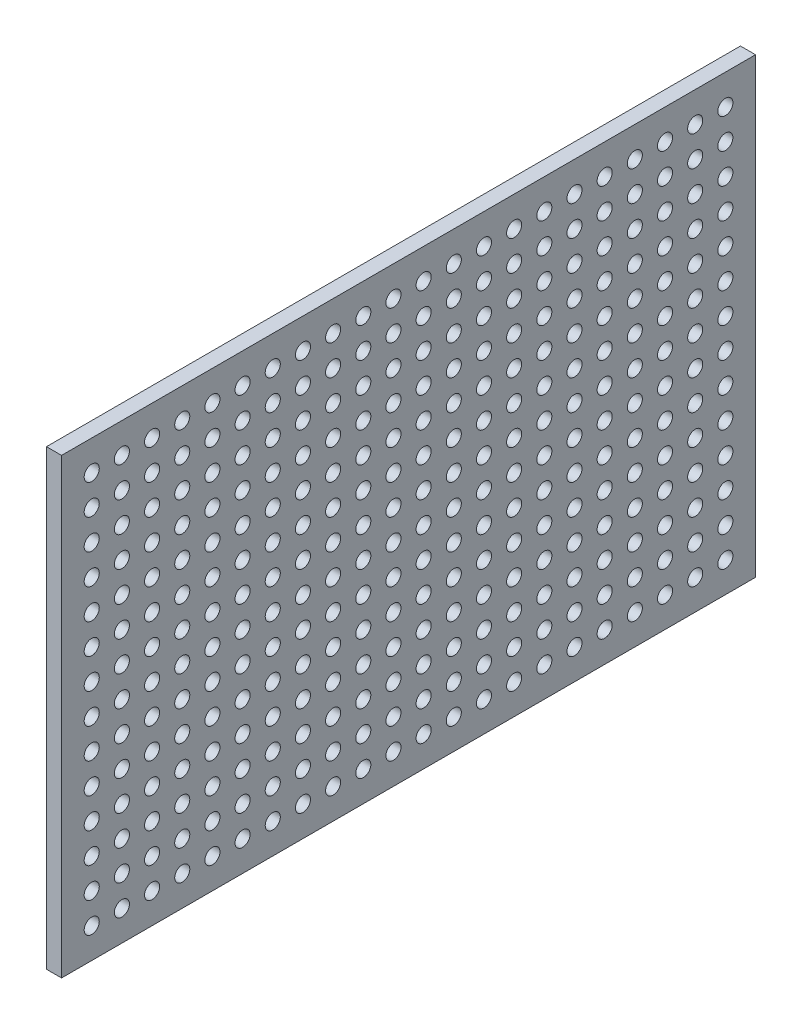
from build123d import *

# Parameters (mm, degrees)
SKIZZE1_W                       = 230
SKIZZE1_H                       = 150
AUFSATZ_LINEAR_AUSTRAGEN1_DEPTH = 5
SKIZZE2_R                       = 2.5
SCHNITT_LINEAR_AUSTRAGEN1_DEPTH = 138.38631664
LINEARES_MUSTER1_OUTLINE_R      = 2.5
LINEARES_MUSTER1_DEPTH          = 5


# Read off the part's stored shape, not the designer's step: Lineares Muster1
with BuildPart() as part:
    # Skizze1 → Aufsatz-Linear austragen1 (new body)
    with BuildSketch(Plane(origin=(0, 0, 0), x_dir=(0, 0, -1), z_dir=(1, 0, 0))):
        Rectangle(SKIZZE1_W, SKIZZE1_H)
    extrude(amount=AUFSATZ_LINEAR_AUSTRAGEN1_DEPTH)

    # Skizze2 → Schnitt-Linear austragen1 (cut, through all)
    with BuildSketch(Plane(origin=(5, 0, 0), x_dir=(0, 0, -1), z_dir=(1, 0, 0))):
        with Locations((-105, 65)):
            Circle(SKIZZE2_R)
    extrude(amount=-SCHNITT_LINEAR_AUSTRAGEN1_DEPTH, mode=Mode.SUBTRACT)

    # Lineares Muster1 outline → Lineares Muster1 (cut)
    with BuildSketch(Plane.YZ):
        with Locations((55, 105)):
            Circle(LINEARES_MUSTER1_OUTLINE_R)
        with Locations((45, 105)):
            Circle(LINEARES_MUSTER1_OUTLINE_R)
        with Locations((35, 105)):
            Circle(LINEARES_MUSTER1_OUTLINE_R)
        with Locations((25, 105)):
            Circle(LINEARES_MUSTER1_OUTLINE_R)
        with Locations((15, 105)):
            Circle(LINEARES_MUSTER1_OUTLINE_R)
        with Locations((5, 105)):
            Circle(LINEARES_MUSTER1_OUTLINE_R)
        with Locations((-5, 105)):
            Circle(LINEARES_MUSTER1_OUTLINE_R)
        with Locations((-15, 105)):
            Circle(LINEARES_MUSTER1_OUTLINE_R)
        with Locations((-25, 105)):
            Circle(LINEARES_MUSTER1_OUTLINE_R)
        with Locations((-35, 105)):
            Circle(LINEARES_MUSTER1_OUTLINE_R)
        with Locations((-45, 105)):
            Circle(LINEARES_MUSTER1_OUTLINE_R)
        with Locations((-55, 105)):
            Circle(LINEARES_MUSTER1_OUTLINE_R)
        with Locations((-65, 105)):
            Circle(LINEARES_MUSTER1_OUTLINE_R)
        with Locations((65, 95)):
            Circle(LINEARES_MUSTER1_OUTLINE_R)
        with Locations((55, 95)):
            Circle(LINEARES_MUSTER1_OUTLINE_R)
        with Locations((45, 95)):
            Circle(LINEARES_MUSTER1_OUTLINE_R)
        with Locations((35, 95)):
            Circle(LINEARES_MUSTER1_OUTLINE_R)
        with Locations((25, 95)):
            Circle(LINEARES_MUSTER1_OUTLINE_R)
        with Locations((15, 95)):
            Circle(LINEARES_MUSTER1_OUTLINE_R)
        with Locations((5, 95)):
            Circle(LINEARES_MUSTER1_OUTLINE_R)
        with Locations((-5, 95)):
            Circle(LINEARES_MUSTER1_OUTLINE_R)
        with Locations((-15, 95)):
            Circle(LINEARES_MUSTER1_OUTLINE_R)
        with Locations((-25, 95)):
            Circle(LINEARES_MUSTER1_OUTLINE_R)
        with Locations((-35, 95)):
            Circle(LINEARES_MUSTER1_OUTLINE_R)
        with Locations((-45, 95)):
            Circle(LINEARES_MUSTER1_OUTLINE_R)
        with Locations((-55, 95)):
            Circle(LINEARES_MUSTER1_OUTLINE_R)
        with Locations((-65, 95)):
            Circle(LINEARES_MUSTER1_OUTLINE_R)
        with Locations((65, 85)):
            Circle(LINEARES_MUSTER1_OUTLINE_R)
        with Locations((55, 85)):
            Circle(LINEARES_MUSTER1_OUTLINE_R)
        with Locations((45, 85)):
            Circle(LINEARES_MUSTER1_OUTLINE_R)
        with Locations((35, 85)):
            Circle(LINEARES_MUSTER1_OUTLINE_R)
        with Locations((25, 85)):
            Circle(LINEARES_MUSTER1_OUTLINE_R)
        with Locations((15, 85)):
            Circle(LINEARES_MUSTER1_OUTLINE_R)
        with Locations((5, 85)):
            Circle(LINEARES_MUSTER1_OUTLINE_R)
        with Locations((-5, 85)):
            Circle(LINEARES_MUSTER1_OUTLINE_R)
        with Locations((-15, 85)):
            Circle(LINEARES_MUSTER1_OUTLINE_R)
        with Locations((-25, 85)):
            Circle(LINEARES_MUSTER1_OUTLINE_R)
        with Locations((-35, 85)):
            Circle(LINEARES_MUSTER1_OUTLINE_R)
        with Locations((-45, 85)):
            Circle(LINEARES_MUSTER1_OUTLINE_R)
        with Locations((-55, 85)):
            Circle(LINEARES_MUSTER1_OUTLINE_R)
        with Locations((-65, 85)):
            Circle(LINEARES_MUSTER1_OUTLINE_R)
        with Locations((65, 75)):
            Circle(LINEARES_MUSTER1_OUTLINE_R)
        with Locations((55, 75)):
            Circle(LINEARES_MUSTER1_OUTLINE_R)
        with Locations((45, 75)):
            Circle(LINEARES_MUSTER1_OUTLINE_R)
        with Locations((35, 75)):
            Circle(LINEARES_MUSTER1_OUTLINE_R)
        with Locations((25, 75)):
            Circle(LINEARES_MUSTER1_OUTLINE_R)
        with Locations((15, 75)):
            Circle(LINEARES_MUSTER1_OUTLINE_R)
        with Locations((5, 75)):
            Circle(LINEARES_MUSTER1_OUTLINE_R)
        with Locations((-5, 75)):
            Circle(LINEARES_MUSTER1_OUTLINE_R)
        with Locations((-15, 75)):
            Circle(LINEARES_MUSTER1_OUTLINE_R)
        with Locations((-25, 75)):
            Circle(LINEARES_MUSTER1_OUTLINE_R)
        with Locations((-35, 75)):
            Circle(LINEARES_MUSTER1_OUTLINE_R)
        with Locations((-45, 75)):
            Circle(LINEARES_MUSTER1_OUTLINE_R)
        with Locations((-55, 75)):
            Circle(LINEARES_MUSTER1_OUTLINE_R)
        with Locations((-65, 75)):
            Circle(LINEARES_MUSTER1_OUTLINE_R)
        with Locations((65, 65)):
            Circle(LINEARES_MUSTER1_OUTLINE_R)
        with Locations((55, 65)):
            Circle(LINEARES_MUSTER1_OUTLINE_R)
        with Locations((45, 65)):
            Circle(LINEARES_MUSTER1_OUTLINE_R)
        with Locations((35, 65)):
            Circle(LINEARES_MUSTER1_OUTLINE_R)
        with Locations((25, 65)):
            Circle(LINEARES_MUSTER1_OUTLINE_R)
        with Locations((15, 65)):
            Circle(LINEARES_MUSTER1_OUTLINE_R)
        with Locations((5, 65)):
            Circle(LINEARES_MUSTER1_OUTLINE_R)
        with Locations((-5, 65)):
            Circle(LINEARES_MUSTER1_OUTLINE_R)
        with Locations((-15, 65)):
            Circle(LINEARES_MUSTER1_OUTLINE_R)
        with Locations((-25, 65)):
            Circle(LINEARES_MUSTER1_OUTLINE_R)
        with Locations((-35, 65)):
            Circle(LINEARES_MUSTER1_OUTLINE_R)
        with Locations((-45, 65)):
            Circle(LINEARES_MUSTER1_OUTLINE_R)
        with Locations((-55, 65)):
            Circle(LINEARES_MUSTER1_OUTLINE_R)
        with Locations((-65, 65)):
            Circle(LINEARES_MUSTER1_OUTLINE_R)
        with Locations((65, 55)):
            Circle(LINEARES_MUSTER1_OUTLINE_R)
        with Locations((55, 55)):
            Circle(LINEARES_MUSTER1_OUTLINE_R)
        with Locations((45, 55)):
            Circle(LINEARES_MUSTER1_OUTLINE_R)
        with Locations((35, 55)):
            Circle(LINEARES_MUSTER1_OUTLINE_R)
        with Locations((25, 55)):
            Circle(LINEARES_MUSTER1_OUTLINE_R)
        with Locations((15, 55)):
            Circle(LINEARES_MUSTER1_OUTLINE_R)
        with Locations((5, 55)):
            Circle(LINEARES_MUSTER1_OUTLINE_R)
        with Locations((-5, 55)):
            Circle(LINEARES_MUSTER1_OUTLINE_R)
        with Locations((-15, 55)):
            Circle(LINEARES_MUSTER1_OUTLINE_R)
        with Locations((-25, 55)):
            Circle(LINEARES_MUSTER1_OUTLINE_R)
        with Locations((-35, 55)):
            Circle(LINEARES_MUSTER1_OUTLINE_R)
        with Locations((-45, 55)):
            Circle(LINEARES_MUSTER1_OUTLINE_R)
        with Locations((-55, 55)):
            Circle(LINEARES_MUSTER1_OUTLINE_R)
        with Locations((-65, 55)):
            Circle(LINEARES_MUSTER1_OUTLINE_R)
        with Locations((65, 45)):
            Circle(LINEARES_MUSTER1_OUTLINE_R)
        with Locations((55, 45)):
            Circle(LINEARES_MUSTER1_OUTLINE_R)
        with Locations((45, 45)):
            Circle(LINEARES_MUSTER1_OUTLINE_R)
        with Locations((35, 45)):
            Circle(LINEARES_MUSTER1_OUTLINE_R)
        with Locations((25, 45)):
            Circle(LINEARES_MUSTER1_OUTLINE_R)
        with Locations((15, 45)):
            Circle(LINEARES_MUSTER1_OUTLINE_R)
        with Locations((5, 45)):
            Circle(LINEARES_MUSTER1_OUTLINE_R)
        with Locations((-5, 45)):
            Circle(LINEARES_MUSTER1_OUTLINE_R)
        with Locations((-15, 45)):
            Circle(LINEARES_MUSTER1_OUTLINE_R)
        with Locations((-25, 45)):
            Circle(LINEARES_MUSTER1_OUTLINE_R)
        with Locations((-35, 45)):
            Circle(LINEARES_MUSTER1_OUTLINE_R)
        with Locations((-45, 45)):
            Circle(LINEARES_MUSTER1_OUTLINE_R)
        with Locations((-55, 45)):
            Circle(LINEARES_MUSTER1_OUTLINE_R)
        with Locations((-65, 45)):
            Circle(LINEARES_MUSTER1_OUTLINE_R)
        with Locations((65, 35)):
            Circle(LINEARES_MUSTER1_OUTLINE_R)
        with Locations((55, 35)):
            Circle(LINEARES_MUSTER1_OUTLINE_R)
        with Locations((45, 35)):
            Circle(LINEARES_MUSTER1_OUTLINE_R)
        with Locations((35, 35)):
            Circle(LINEARES_MUSTER1_OUTLINE_R)
        with Locations((25, 35)):
            Circle(LINEARES_MUSTER1_OUTLINE_R)
        with Locations((15, 35)):
            Circle(LINEARES_MUSTER1_OUTLINE_R)
        with Locations((5, 35)):
            Circle(LINEARES_MUSTER1_OUTLINE_R)
        with Locations((-5, 35)):
            Circle(LINEARES_MUSTER1_OUTLINE_R)
        with Locations((-15, 35)):
            Circle(LINEARES_MUSTER1_OUTLINE_R)
        with Locations((-25, 35)):
            Circle(LINEARES_MUSTER1_OUTLINE_R)
        with Locations((-35, 35)):
            Circle(LINEARES_MUSTER1_OUTLINE_R)
        with Locations((-45, 35)):
            Circle(LINEARES_MUSTER1_OUTLINE_R)
        with Locations((-55, 35)):
            Circle(LINEARES_MUSTER1_OUTLINE_R)
        with Locations((-65, 35)):
            Circle(LINEARES_MUSTER1_OUTLINE_R)
        with Locations((65, 25)):
            Circle(LINEARES_MUSTER1_OUTLINE_R)
        with Locations((55, 25)):
            Circle(LINEARES_MUSTER1_OUTLINE_R)
        with Locations((45, 25)):
            Circle(LINEARES_MUSTER1_OUTLINE_R)
        with Locations((35, 25)):
            Circle(LINEARES_MUSTER1_OUTLINE_R)
        with Locations((25, 25)):
            Circle(LINEARES_MUSTER1_OUTLINE_R)
        with Locations((15, 25)):
            Circle(LINEARES_MUSTER1_OUTLINE_R)
        with Locations((5, 25)):
            Circle(LINEARES_MUSTER1_OUTLINE_R)
        with Locations((-5, 25)):
            Circle(LINEARES_MUSTER1_OUTLINE_R)
        with Locations((-15, 25)):
            Circle(LINEARES_MUSTER1_OUTLINE_R)
        with Locations((-25, 25)):
            Circle(LINEARES_MUSTER1_OUTLINE_R)
        with Locations((-35, 25)):
            Circle(LINEARES_MUSTER1_OUTLINE_R)
        with Locations((-45, 25)):
            Circle(LINEARES_MUSTER1_OUTLINE_R)
        with Locations((-55, 25)):
            Circle(LINEARES_MUSTER1_OUTLINE_R)
        with Locations((-65, 25)):
            Circle(LINEARES_MUSTER1_OUTLINE_R)
        with Locations((65, 15)):
            Circle(LINEARES_MUSTER1_OUTLINE_R)
        with Locations((55, 15)):
            Circle(LINEARES_MUSTER1_OUTLINE_R)
        with Locations((45, 15)):
            Circle(LINEARES_MUSTER1_OUTLINE_R)
        with Locations((35, 15)):
            Circle(LINEARES_MUSTER1_OUTLINE_R)
        with Locations((25, 15)):
            Circle(LINEARES_MUSTER1_OUTLINE_R)
        with Locations((15, 15)):
            Circle(LINEARES_MUSTER1_OUTLINE_R)
        with Locations((5, 15)):
            Circle(LINEARES_MUSTER1_OUTLINE_R)
        with Locations((-5, 15)):
            Circle(LINEARES_MUSTER1_OUTLINE_R)
        with Locations((-15, 15)):
            Circle(LINEARES_MUSTER1_OUTLINE_R)
        with Locations((-25, 15)):
            Circle(LINEARES_MUSTER1_OUTLINE_R)
        with Locations((-35, 15)):
            Circle(LINEARES_MUSTER1_OUTLINE_R)
        with Locations((-45, 15)):
            Circle(LINEARES_MUSTER1_OUTLINE_R)
        with Locations((-55, 15)):
            Circle(LINEARES_MUSTER1_OUTLINE_R)
        with Locations((-65, 15)):
            Circle(LINEARES_MUSTER1_OUTLINE_R)
        with Locations((65, 5)):
            Circle(LINEARES_MUSTER1_OUTLINE_R)
        with Locations((55, 5)):
            Circle(LINEARES_MUSTER1_OUTLINE_R)
        with Locations((45, 5)):
            Circle(LINEARES_MUSTER1_OUTLINE_R)
        with Locations((35, 5)):
            Circle(LINEARES_MUSTER1_OUTLINE_R)
        with Locations((25, 5)):
            Circle(LINEARES_MUSTER1_OUTLINE_R)
        with Locations((15, 5)):
            Circle(LINEARES_MUSTER1_OUTLINE_R)
        with Locations((5, 5)):
            Circle(LINEARES_MUSTER1_OUTLINE_R)
        with Locations((-5, 5)):
            Circle(LINEARES_MUSTER1_OUTLINE_R)
        with Locations((-15, 5)):
            Circle(LINEARES_MUSTER1_OUTLINE_R)
        with Locations((-25, 5)):
            Circle(LINEARES_MUSTER1_OUTLINE_R)
        with Locations((-35, 5)):
            Circle(LINEARES_MUSTER1_OUTLINE_R)
        with Locations((-45, 5)):
            Circle(LINEARES_MUSTER1_OUTLINE_R)
        with Locations((-55, 5)):
            Circle(LINEARES_MUSTER1_OUTLINE_R)
        with Locations((-65, 5)):
            Circle(LINEARES_MUSTER1_OUTLINE_R)
        with Locations((65, -5)):
            Circle(LINEARES_MUSTER1_OUTLINE_R)
        with Locations((55, -5)):
            Circle(LINEARES_MUSTER1_OUTLINE_R)
        with Locations((45, -5)):
            Circle(LINEARES_MUSTER1_OUTLINE_R)
        with Locations((35, -5)):
            Circle(LINEARES_MUSTER1_OUTLINE_R)
        with Locations((25, -5)):
            Circle(LINEARES_MUSTER1_OUTLINE_R)
        with Locations((15, -5)):
            Circle(LINEARES_MUSTER1_OUTLINE_R)
        with Locations((5, -5)):
            Circle(LINEARES_MUSTER1_OUTLINE_R)
        with Locations((-5, -5)):
            Circle(LINEARES_MUSTER1_OUTLINE_R)
        with Locations((-15, -5)):
            Circle(LINEARES_MUSTER1_OUTLINE_R)
        with Locations((-25, -5)):
            Circle(LINEARES_MUSTER1_OUTLINE_R)
        with Locations((-35, -5)):
            Circle(LINEARES_MUSTER1_OUTLINE_R)
        with Locations((-45, -5)):
            Circle(LINEARES_MUSTER1_OUTLINE_R)
        with Locations((-55, -5)):
            Circle(LINEARES_MUSTER1_OUTLINE_R)
        with Locations((-65, -5)):
            Circle(LINEARES_MUSTER1_OUTLINE_R)
        with Locations((65, -15)):
            Circle(LINEARES_MUSTER1_OUTLINE_R)
        with Locations((55, -15)):
            Circle(LINEARES_MUSTER1_OUTLINE_R)
        with Locations((45, -15)):
            Circle(LINEARES_MUSTER1_OUTLINE_R)
        with Locations((35, -15)):
            Circle(LINEARES_MUSTER1_OUTLINE_R)
        with Locations((25, -15)):
            Circle(LINEARES_MUSTER1_OUTLINE_R)
        with Locations((15, -15)):
            Circle(LINEARES_MUSTER1_OUTLINE_R)
        with Locations((5, -15)):
            Circle(LINEARES_MUSTER1_OUTLINE_R)
        with Locations((-5, -15)):
            Circle(LINEARES_MUSTER1_OUTLINE_R)
        with Locations((-15, -15)):
            Circle(LINEARES_MUSTER1_OUTLINE_R)
        with Locations((-25, -15)):
            Circle(LINEARES_MUSTER1_OUTLINE_R)
        with Locations((-35, -15)):
            Circle(LINEARES_MUSTER1_OUTLINE_R)
        with Locations((-45, -15)):
            Circle(LINEARES_MUSTER1_OUTLINE_R)
        with Locations((-55, -15)):
            Circle(LINEARES_MUSTER1_OUTLINE_R)
        with Locations((-65, -15)):
            Circle(LINEARES_MUSTER1_OUTLINE_R)
        with Locations((65, -25)):
            Circle(LINEARES_MUSTER1_OUTLINE_R)
        with Locations((55, -25)):
            Circle(LINEARES_MUSTER1_OUTLINE_R)
        with Locations((45, -25)):
            Circle(LINEARES_MUSTER1_OUTLINE_R)
        with Locations((35, -25)):
            Circle(LINEARES_MUSTER1_OUTLINE_R)
        with Locations((25, -25)):
            Circle(LINEARES_MUSTER1_OUTLINE_R)
        with Locations((15, -25)):
            Circle(LINEARES_MUSTER1_OUTLINE_R)
        with Locations((5, -25)):
            Circle(LINEARES_MUSTER1_OUTLINE_R)
        with Locations((-5, -25)):
            Circle(LINEARES_MUSTER1_OUTLINE_R)
        with Locations((-15, -25)):
            Circle(LINEARES_MUSTER1_OUTLINE_R)
        with Locations((-25, -25)):
            Circle(LINEARES_MUSTER1_OUTLINE_R)
        with Locations((-35, -25)):
            Circle(LINEARES_MUSTER1_OUTLINE_R)
        with Locations((-45, -25)):
            Circle(LINEARES_MUSTER1_OUTLINE_R)
        with Locations((-55, -25)):
            Circle(LINEARES_MUSTER1_OUTLINE_R)
        with Locations((-65, -25)):
            Circle(LINEARES_MUSTER1_OUTLINE_R)
        with Locations((65, -35)):
            Circle(LINEARES_MUSTER1_OUTLINE_R)
        with Locations((55, -35)):
            Circle(LINEARES_MUSTER1_OUTLINE_R)
        with Locations((45, -35)):
            Circle(LINEARES_MUSTER1_OUTLINE_R)
        with Locations((35, -35)):
            Circle(LINEARES_MUSTER1_OUTLINE_R)
        with Locations((25, -35)):
            Circle(LINEARES_MUSTER1_OUTLINE_R)
        with Locations((15, -35)):
            Circle(LINEARES_MUSTER1_OUTLINE_R)
        with Locations((5, -35)):
            Circle(LINEARES_MUSTER1_OUTLINE_R)
        with Locations((-5, -35)):
            Circle(LINEARES_MUSTER1_OUTLINE_R)
        with Locations((-15, -35)):
            Circle(LINEARES_MUSTER1_OUTLINE_R)
        with Locations((-25, -35)):
            Circle(LINEARES_MUSTER1_OUTLINE_R)
        with Locations((-35, -35)):
            Circle(LINEARES_MUSTER1_OUTLINE_R)
        with Locations((-45, -35)):
            Circle(LINEARES_MUSTER1_OUTLINE_R)
        with Locations((-55, -35)):
            Circle(LINEARES_MUSTER1_OUTLINE_R)
        with Locations((-65, -35)):
            Circle(LINEARES_MUSTER1_OUTLINE_R)
        with Locations((65, -45)):
            Circle(LINEARES_MUSTER1_OUTLINE_R)
        with Locations((55, -45)):
            Circle(LINEARES_MUSTER1_OUTLINE_R)
        with Locations((45, -45)):
            Circle(LINEARES_MUSTER1_OUTLINE_R)
        with Locations((35, -45)):
            Circle(LINEARES_MUSTER1_OUTLINE_R)
        with Locations((25, -45)):
            Circle(LINEARES_MUSTER1_OUTLINE_R)
        with Locations((15, -45)):
            Circle(LINEARES_MUSTER1_OUTLINE_R)
        with Locations((5, -45)):
            Circle(LINEARES_MUSTER1_OUTLINE_R)
        with Locations((-5, -45)):
            Circle(LINEARES_MUSTER1_OUTLINE_R)
        with Locations((-15, -45)):
            Circle(LINEARES_MUSTER1_OUTLINE_R)
        with Locations((-25, -45)):
            Circle(LINEARES_MUSTER1_OUTLINE_R)
        with Locations((-35, -45)):
            Circle(LINEARES_MUSTER1_OUTLINE_R)
        with Locations((-45, -45)):
            Circle(LINEARES_MUSTER1_OUTLINE_R)
        with Locations((-55, -45)):
            Circle(LINEARES_MUSTER1_OUTLINE_R)
        with Locations((-65, -45)):
            Circle(LINEARES_MUSTER1_OUTLINE_R)
        with Locations((65, -55)):
            Circle(LINEARES_MUSTER1_OUTLINE_R)
        with Locations((55, -55)):
            Circle(LINEARES_MUSTER1_OUTLINE_R)
        with Locations((45, -55)):
            Circle(LINEARES_MUSTER1_OUTLINE_R)
        with Locations((35, -55)):
            Circle(LINEARES_MUSTER1_OUTLINE_R)
        with Locations((25, -55)):
            Circle(LINEARES_MUSTER1_OUTLINE_R)
        with Locations((15, -55)):
            Circle(LINEARES_MUSTER1_OUTLINE_R)
        with Locations((5, -55)):
            Circle(LINEARES_MUSTER1_OUTLINE_R)
        with Locations((-5, -55)):
            Circle(LINEARES_MUSTER1_OUTLINE_R)
        with Locations((-15, -55)):
            Circle(LINEARES_MUSTER1_OUTLINE_R)
        with Locations((-25, -55)):
            Circle(LINEARES_MUSTER1_OUTLINE_R)
        with Locations((-35, -55)):
            Circle(LINEARES_MUSTER1_OUTLINE_R)
        with Locations((-45, -55)):
            Circle(LINEARES_MUSTER1_OUTLINE_R)
        with Locations((-55, -55)):
            Circle(LINEARES_MUSTER1_OUTLINE_R)
        with Locations((-65, -55)):
            Circle(LINEARES_MUSTER1_OUTLINE_R)
        with Locations((65, -65)):
            Circle(LINEARES_MUSTER1_OUTLINE_R)
        with Locations((55, -65)):
            Circle(LINEARES_MUSTER1_OUTLINE_R)
        with Locations((45, -65)):
            Circle(LINEARES_MUSTER1_OUTLINE_R)
        with Locations((35, -65)):
            Circle(LINEARES_MUSTER1_OUTLINE_R)
        with Locations((25, -65)):
            Circle(LINEARES_MUSTER1_OUTLINE_R)
        with Locations((15, -65)):
            Circle(LINEARES_MUSTER1_OUTLINE_R)
        with Locations((5, -65)):
            Circle(LINEARES_MUSTER1_OUTLINE_R)
        with Locations((-5, -65)):
            Circle(LINEARES_MUSTER1_OUTLINE_R)
        with Locations((-15, -65)):
            Circle(LINEARES_MUSTER1_OUTLINE_R)
        with Locations((-25, -65)):
            Circle(LINEARES_MUSTER1_OUTLINE_R)
        with Locations((-35, -65)):
            Circle(LINEARES_MUSTER1_OUTLINE_R)
        with Locations((-45, -65)):
            Circle(LINEARES_MUSTER1_OUTLINE_R)
        with Locations((-55, -65)):
            Circle(LINEARES_MUSTER1_OUTLINE_R)
        with Locations((-65, -65)):
            Circle(LINEARES_MUSTER1_OUTLINE_R)
        with Locations((65, -75)):
            Circle(LINEARES_MUSTER1_OUTLINE_R)
        with Locations((55, -75)):
            Circle(LINEARES_MUSTER1_OUTLINE_R)
        with Locations((45, -75)):
            Circle(LINEARES_MUSTER1_OUTLINE_R)
        with Locations((35, -75)):
            Circle(LINEARES_MUSTER1_OUTLINE_R)
        with Locations((25, -75)):
            Circle(LINEARES_MUSTER1_OUTLINE_R)
        with Locations((15, -75)):
            Circle(LINEARES_MUSTER1_OUTLINE_R)
        with Locations((5, -75)):
            Circle(LINEARES_MUSTER1_OUTLINE_R)
        with Locations((-5, -75)):
            Circle(LINEARES_MUSTER1_OUTLINE_R)
        with Locations((-15, -75)):
            Circle(LINEARES_MUSTER1_OUTLINE_R)
        with Locations((-25, -75)):
            Circle(LINEARES_MUSTER1_OUTLINE_R)
        with Locations((-35, -75)):
            Circle(LINEARES_MUSTER1_OUTLINE_R)
        with Locations((-45, -75)):
            Circle(LINEARES_MUSTER1_OUTLINE_R)
        with Locations((-55, -75)):
            Circle(LINEARES_MUSTER1_OUTLINE_R)
        with Locations((-65, -75)):
            Circle(LINEARES_MUSTER1_OUTLINE_R)
        with Locations((65, -85)):
            Circle(LINEARES_MUSTER1_OUTLINE_R)
        with Locations((55, -85)):
            Circle(LINEARES_MUSTER1_OUTLINE_R)
        with Locations((45, -85)):
            Circle(LINEARES_MUSTER1_OUTLINE_R)
        with Locations((35, -85)):
            Circle(LINEARES_MUSTER1_OUTLINE_R)
        with Locations((25, -85)):
            Circle(LINEARES_MUSTER1_OUTLINE_R)
        with Locations((15, -85)):
            Circle(LINEARES_MUSTER1_OUTLINE_R)
        with Locations((5, -85)):
            Circle(LINEARES_MUSTER1_OUTLINE_R)
        with Locations((-5, -85)):
            Circle(LINEARES_MUSTER1_OUTLINE_R)
        with Locations((-15, -85)):
            Circle(LINEARES_MUSTER1_OUTLINE_R)
        with Locations((-25, -85)):
            Circle(LINEARES_MUSTER1_OUTLINE_R)
        with Locations((-35, -85)):
            Circle(LINEARES_MUSTER1_OUTLINE_R)
        with Locations((-45, -85)):
            Circle(LINEARES_MUSTER1_OUTLINE_R)
        with Locations((-55, -85)):
            Circle(LINEARES_MUSTER1_OUTLINE_R)
        with Locations((-65, -85)):
            Circle(LINEARES_MUSTER1_OUTLINE_R)
        with Locations((65, -95)):
            Circle(LINEARES_MUSTER1_OUTLINE_R)
        with Locations((55, -95)):
            Circle(LINEARES_MUSTER1_OUTLINE_R)
        with Locations((45, -95)):
            Circle(LINEARES_MUSTER1_OUTLINE_R)
        with Locations((35, -95)):
            Circle(LINEARES_MUSTER1_OUTLINE_R)
        with Locations((25, -95)):
            Circle(LINEARES_MUSTER1_OUTLINE_R)
        with Locations((15, -95)):
            Circle(LINEARES_MUSTER1_OUTLINE_R)
        with Locations((5, -95)):
            Circle(LINEARES_MUSTER1_OUTLINE_R)
        with Locations((-5, -95)):
            Circle(LINEARES_MUSTER1_OUTLINE_R)
        with Locations((-15, -95)):
            Circle(LINEARES_MUSTER1_OUTLINE_R)
        with Locations((-25, -95)):
            Circle(LINEARES_MUSTER1_OUTLINE_R)
        with Locations((-35, -95)):
            Circle(LINEARES_MUSTER1_OUTLINE_R)
        with Locations((-45, -95)):
            Circle(LINEARES_MUSTER1_OUTLINE_R)
        with Locations((-55, -95)):
            Circle(LINEARES_MUSTER1_OUTLINE_R)
        with Locations((-65, -95)):
            Circle(LINEARES_MUSTER1_OUTLINE_R)
        with Locations((65, -105)):
            Circle(LINEARES_MUSTER1_OUTLINE_R)
        with Locations((55, -105)):
            Circle(LINEARES_MUSTER1_OUTLINE_R)
        with Locations((45, -105)):
            Circle(LINEARES_MUSTER1_OUTLINE_R)
        with Locations((35, -105)):
            Circle(LINEARES_MUSTER1_OUTLINE_R)
        with Locations((25, -105)):
            Circle(LINEARES_MUSTER1_OUTLINE_R)
        with Locations((15, -105)):
            Circle(LINEARES_MUSTER1_OUTLINE_R)
        with Locations((5, -105)):
            Circle(LINEARES_MUSTER1_OUTLINE_R)
        with Locations((-5, -105)):
            Circle(LINEARES_MUSTER1_OUTLINE_R)
        with Locations((-15, -105)):
            Circle(LINEARES_MUSTER1_OUTLINE_R)
        with Locations((-25, -105)):
            Circle(LINEARES_MUSTER1_OUTLINE_R)
        with Locations((-35, -105)):
            Circle(LINEARES_MUSTER1_OUTLINE_R)
        with Locations((-45, -105)):
            Circle(LINEARES_MUSTER1_OUTLINE_R)
        with Locations((-55, -105)):
            Circle(LINEARES_MUSTER1_OUTLINE_R)
        with Locations((-65, -105)):
            Circle(LINEARES_MUSTER1_OUTLINE_R)
    extrude(amount=LINEARES_MUSTER1_DEPTH, mode=Mode.SUBTRACT)


solid = part.part
